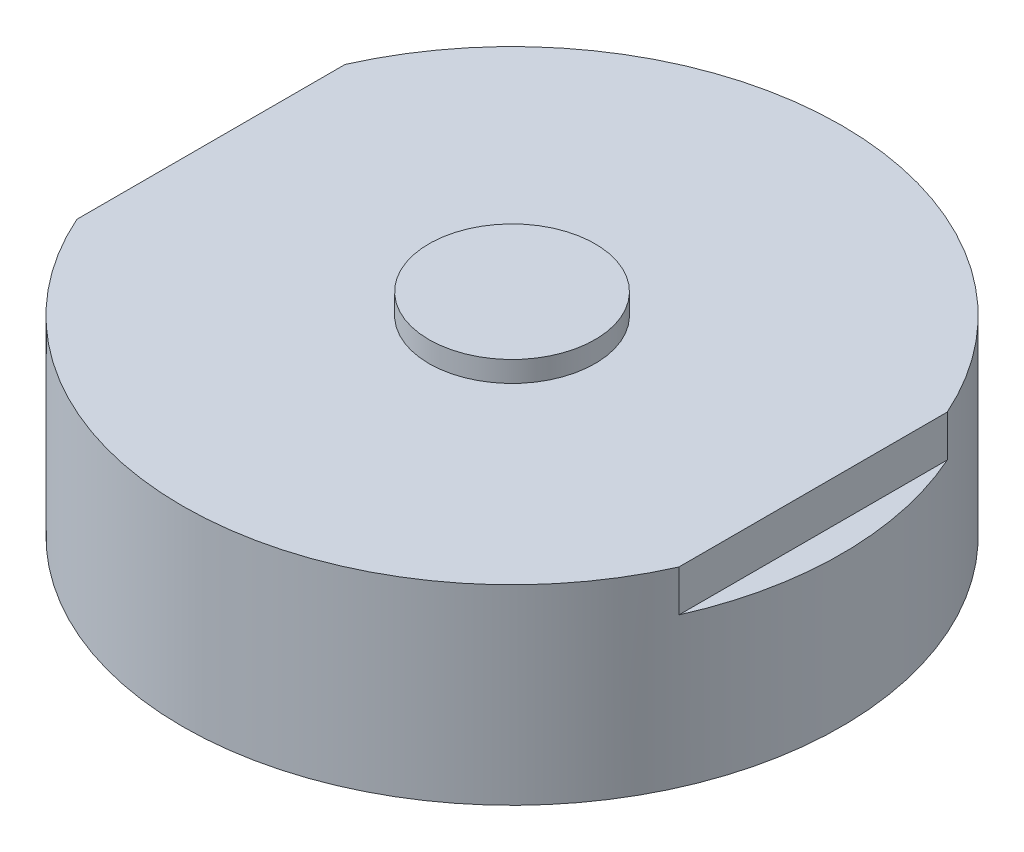
from build123d import *

# Parameters (mm, degrees)
SKETCH1_R           = 15.875
BOSS_EXTRUDE1_DEPTH = 9.2
SKETCH2_W           = 2.259426776
SKETCH2_H           = 16.292984729
SKETCH2_W_2         = 2.453909841
SKETCH2_H_2         = 18.61191006
CUT_EXTRUDE2_DEPTH  = 2
SKETCH3_R           = 4
BOSS_EXTRUDE3_DEPTH = 1
SKETCH4_R           = 1.109491022
CUT_EXTRUDE3_DEPTH  = 1


with BuildPart() as part:
    # Sketch1 → Boss-Extrude1 (new body)
    with BuildSketch(Plane(origin=(0, 0, 0), x_dir=(1, 0, 0), z_dir=(0, 1, 0))):
        Circle(SKETCH1_R)
    extrude(amount=BOSS_EXTRUDE1_DEPTH)

    # Sketch2 → Cut-Extrude2 (cut)
    with BuildSketch(Plane(origin=(0, 9.2, 0), x_dir=(1, 0, 0), z_dir=(0, 1, 0))):
        with Locations((-15.629713388, -0.847675915)):
            Rectangle(SKETCH2_W, SKETCH2_H)
        with Locations((15.726954921, -2.007138581)):
            Rectangle(SKETCH2_W_2, SKETCH2_H_2)
    extrude(amount=-CUT_EXTRUDE2_DEPTH, mode=Mode.SUBTRACT)

    # Sketch3 → Boss-Extrude3 (add)
    with BuildSketch(Plane(origin=(0, 9.2, 0), x_dir=(1, 0, 0), z_dir=(0, 1, 0))):
        Circle(SKETCH3_R)
    extrude(amount=BOSS_EXTRUDE3_DEPTH)

    # Sketch4 → Cut-Extrude3 (cut)
    with BuildSketch(Plane.XZ):
        with Locations((0, -12.7)):
            Circle(SKETCH4_R)
        with Locations((0, 12.7)):
            Circle(SKETCH4_R)
    extrude(amount=-CUT_EXTRUDE3_DEPTH, mode=Mode.SUBTRACT)


solid = part.part
